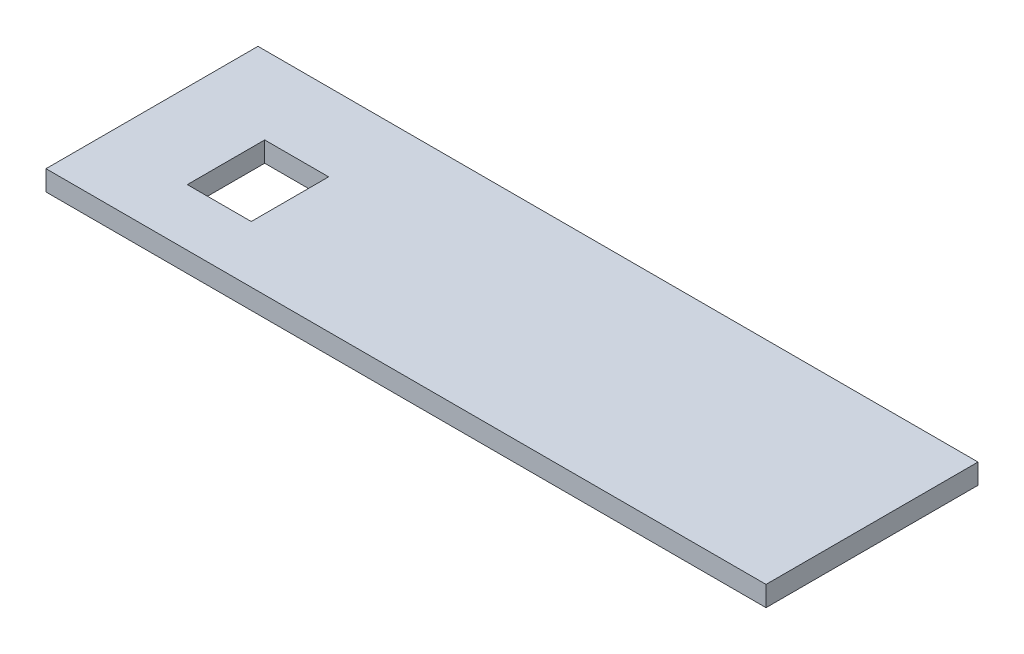
from build123d import *

# Parameters (mm, degrees)
SKETCH_1_W      = 107
SKETCH_1_H      = 31.5
SKETCH_1_W_2    = 9.5
SKETCH_1_H_2    = 11.5
EXTRUDE_1_DEPTH = 3


with BuildPart() as part:
    # Эскиз1 → Бобышка-Вытянуть1 (new body)
    with BuildSketch(Plane(origin=(0, 0, 0), x_dir=(1, 0, 0), z_dir=(0, 1, 0))):
        with Locations((53.5, -15.75)):
            Rectangle(SKETCH_1_W, SKETCH_1_H)
        with Locations((17.3, -17.3)):
            Rectangle(SKETCH_1_W_2, SKETCH_1_H_2, mode=Mode.SUBTRACT)
    extrude(amount=EXTRUDE_1_DEPTH)


solid = part.part
